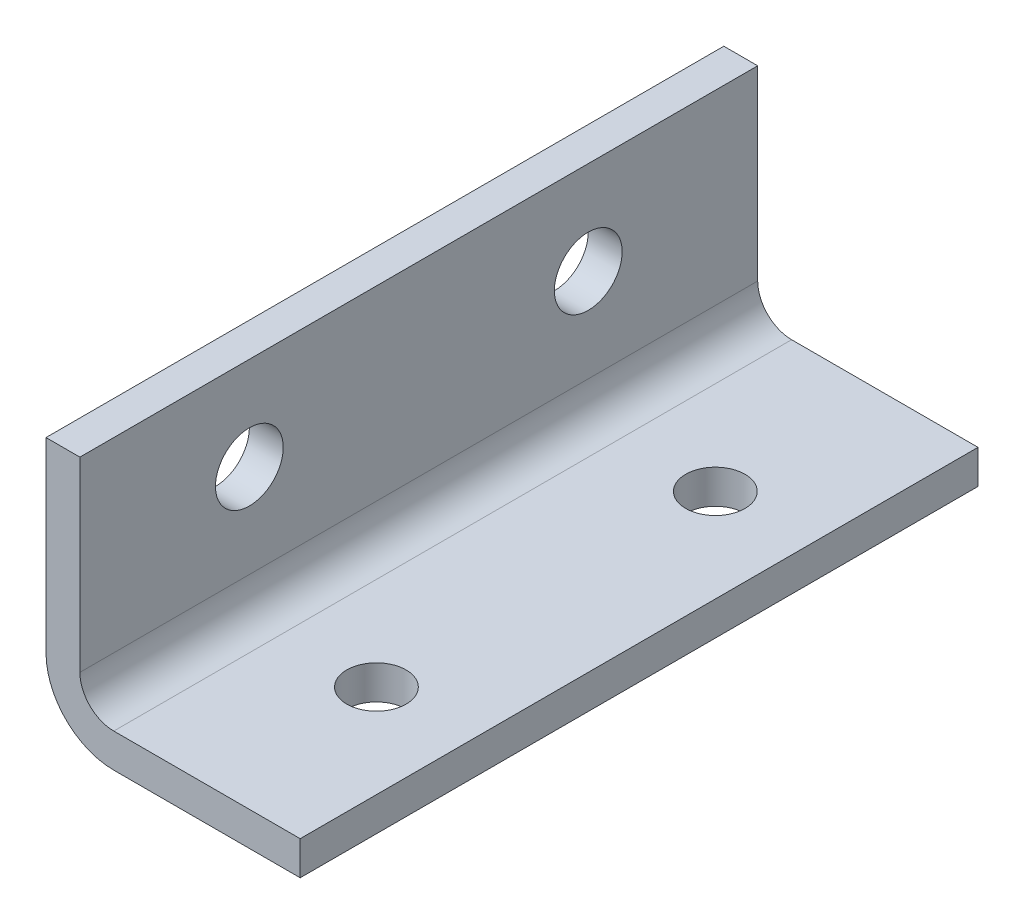
from build123d import *

# Parameters (mm, degrees)
BOSS_EXTRUDE1_DEPTH = 20
SKETCH2_R           = 2
CUT_EXTRUDE1_DEPTH  = 29.178005607
SKETCH3_R           = 1.75
CUT_EXTRUDE2_DEPTH  = 29.178005607


with BuildPart() as part:
    # Sketch1 → Boss-Extrude1 (new, symmetric)
    with BuildSketch(Plane.XY):
        with BuildLine():
            Line((0, 4), (0, 15))
            Line((0, 15), (2, 15))
            Line((2, 15), (2, 4))
            ThreePointArc((2, 4), (2.585786438, 2.585786438), (4, 2))
            Line((4, 2), (15, 2))
            Line((15, 2), (15, 0))
            Line((15, 0), (4, 0))
            ThreePointArc((4, 0), (1.171572875, 1.171572875), (0, 4))
        make_face()
    extrude(amount=BOSS_EXTRUDE1_DEPTH, both=True)

    # Sketch2 → Cut-Extrude1 (cut, through all)
    with BuildSketch(Plane(origin=(2, 0, 0), x_dir=(0, 0, -1), z_dir=(1, 0, 0))):
        with Locations((-10, 9.5)):
            Circle(SKETCH2_R)
        with Locations((10, 9.5)):
            Circle(SKETCH2_R)
    extrude(amount=-CUT_EXTRUDE1_DEPTH, mode=Mode.SUBTRACT)

    # Sketch3 → Cut-Extrude2 (cut, through all)
    with BuildSketch(Plane(origin=(0, 2, 0), x_dir=(1, 0, 0), z_dir=(0, 1, 0))):
        with Locations((9.5, -10)):
            Circle(SKETCH3_R)
        with Locations((9.5, 10)):
            Circle(SKETCH3_R)
    extrude(amount=-CUT_EXTRUDE2_DEPTH, mode=Mode.SUBTRACT)


solid = part.part
